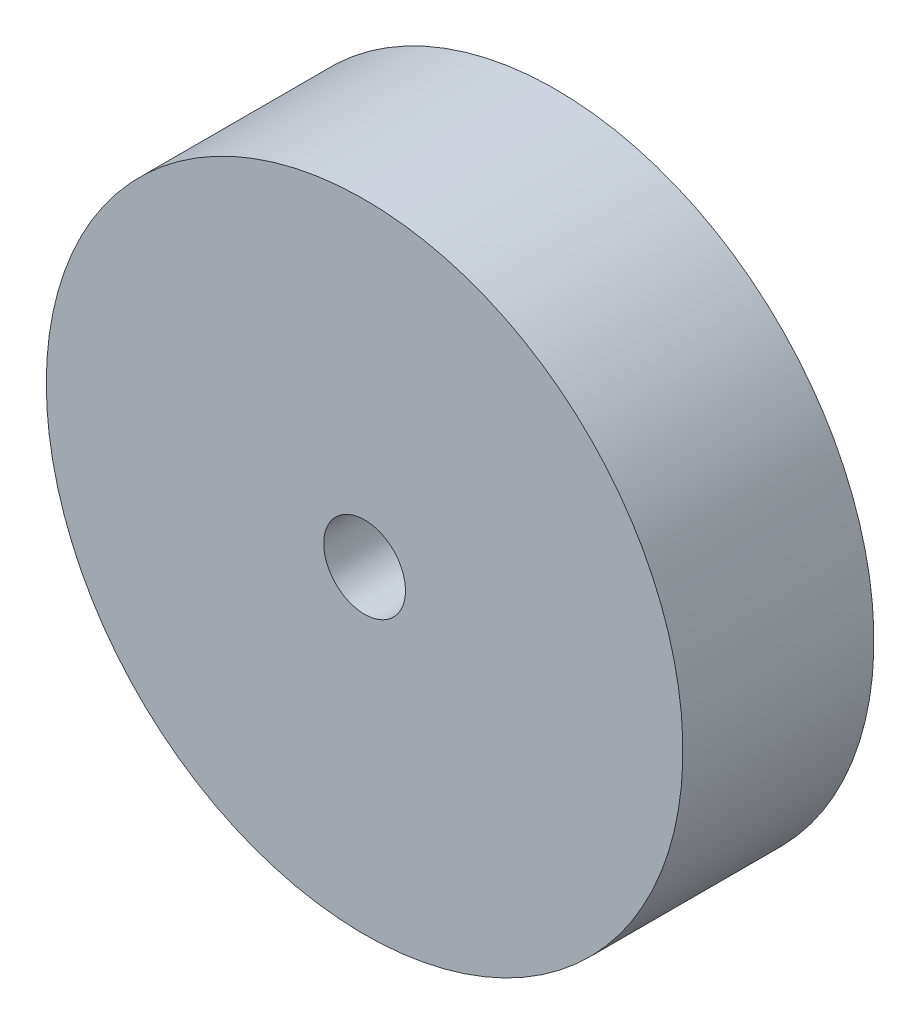
from build123d import *

# Parameters (mm, degrees)
SKETCH1_R             = 12.7
BOSS_EXTRUDE1_DEPTH   = 7.62
F_4_CLEARANCE_HOLE1_D = 3.2639


with BuildPart() as part:
    # Sketch1 → Boss-Extrude1 (new body)
    with BuildSketch(Plane.XY):
        Circle(SKETCH1_R)
    extrude(amount=BOSS_EXTRUDE1_DEPTH)

    # #4 Clearance Hole1 (through all)
    with Locations(Plane.XY.offset(7.62)):
        with Locations((0, 0)):
            Hole(F_4_CLEARANCE_HOLE1_D / 2)


solid = part.part
